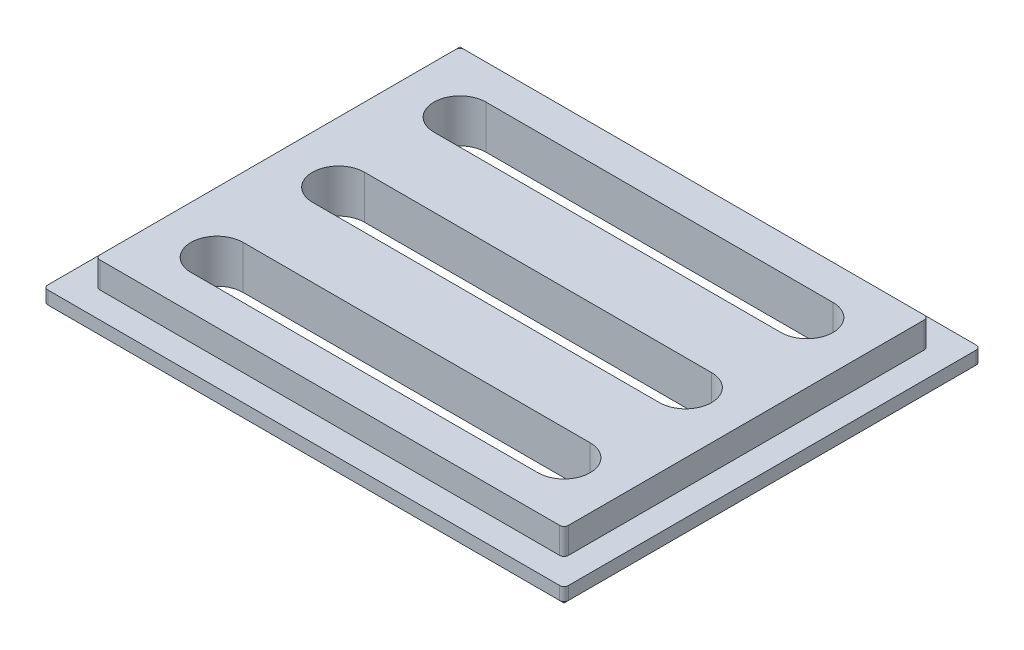
from build123d import *

# Parameters (mm, degrees)
SKETCH1_W           = 60
SKETCH1_H           = 48
BOSS_EXTRUDE1_DEPTH = 2
SKETCH2_W           = 54
SKETCH2_H           = 42
BOSS_EXTRUDE2_DEPTH = 3
CUT_EXTRUDE1_DEPTH  = 50
FILLET1_R           = 0.5
CHAMFER1_SIZE       = 0.5


with BuildPart() as part:
    # Sketch1 → Boss-Extrude1 (new body)
    with BuildSketch(Plane(origin=(0, 0, 0), x_dir=(1, 0, 0), z_dir=(0, 1, 0))):
        Rectangle(SKETCH1_W, SKETCH1_H)
    extrude(amount=BOSS_EXTRUDE1_DEPTH)

    # Sketch2 → Boss-Extrude2 (add)
    with BuildSketch(Plane(origin=(0, 2, 0), x_dir=(1, 0, 0), z_dir=(0, 1, 0))):
        Rectangle(SKETCH2_W, SKETCH2_H)
    extrude(amount=BOSS_EXTRUDE2_DEPTH)

    # Sketch4 → Cut-Extrude1 (cut)
    with BuildSketch(Plane(origin=(0, 5, 0), x_dir=(1, 0, 0), z_dir=(0, 1, 0))):
        with BuildLine():
            Line((-20, -3), (20, -3))
            ThreePointArc((20, -3), (23, 0), (20, 3))
            Line((20, 3), (-20, 3))
            ThreePointArc((-20, 3), (-23, 0), (-20, -3))
        make_face()
        with BuildLine():
            Line((-20, 11), (20, 11))
            ThreePointArc((20, 11), (23, 14), (20, 17))
            Line((20, 17), (-20, 17))
            ThreePointArc((-20, 17), (-23, 14), (-20, 11))
        make_face()
        with BuildLine():
            Line((-20, -17), (20, -17))
            ThreePointArc((20, -17), (23, -14), (20, -11))
            Line((20, -11), (-20, -11))
            ThreePointArc((-20, -11), (-23, -14), (-20, -17))
        make_face()
    extrude(amount=-CUT_EXTRUDE1_DEPTH, mode=Mode.SUBTRACT)

    # Fillet1
    fillet1_edges = [part.edges().sort_by_distance(p)[0] for p in [
        (-27, 3.5, -21),
        (-27, 3.5, 21),
        (27, 3.5, 21),
        (27, 3.5, -21),
        (30, 1, -24),
        (30, 1, 24),
        (-30, 1, 24),
    ]]
    fillet(fillet1_edges, radius=FILLET1_R)

    # Chamfer1
    chamfer1_edges = [part.edges().sort_by_distance(p)[0] for p in [
        (-30, 0, -0.25),
        (0, 0, 24),
        (-0.25, 0, -24),
        (30, 0, 0),
        (29.853553391, 0, -23.853553391),
        (29.853553391, 0, 23.853553391),
        (-29.853553391, 0, 23.853553391),
    ]]
    chamfer(chamfer1_edges, length=CHAMFER1_SIZE - 0.0001)  # a hair under: the kernel refuses the full size


solid = part.part
